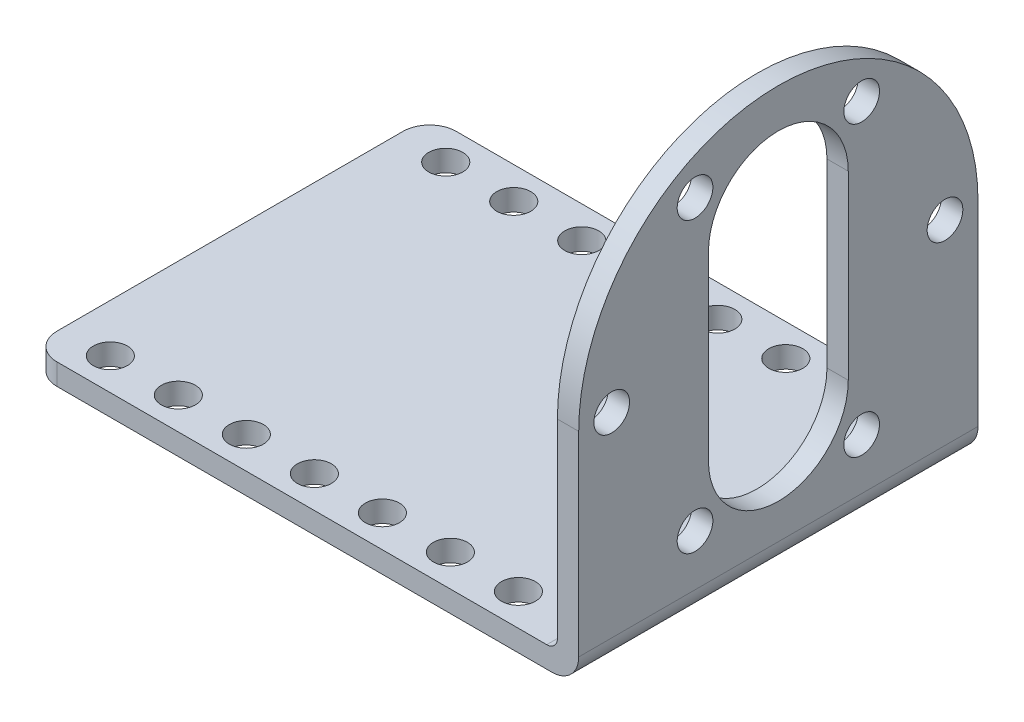
from build123d import *

# Parameters (mm, degrees)
SKETCH1_R           = 1.675
BOSS_EXTRUDE1_DEPTH = 2
SKETCH2_W           = 49.5
SKETCH2_H           = 37.5
SKETCH2_R           = 1.6
BOSS_EXTRUDE2_DEPTH = 2
FILLET1_R           = 2.5
FILLET2_R           = 1


with BuildPart() as part:
    # Sketch1 → Boss-Extrude1 (new body)
    with BuildSketch(Plane(origin=(0, 0, 0), x_dir=(0, 0, -1), z_dir=(1, 0, 0))):
        with BuildLine():
            Line((-18.75, 0), (18.75, 0))
            Line((18.75, 0), (18.75, 20.85))
            ThreePointArc((18.75, 20.85), (0, 39.6), (-18.75, 20.85))
            Line((-18.75, 20.85), (-18.75, 0))
        make_face()
        with Locations((-7.825, 7.296702431)):
            Circle(SKETCH1_R, mode=Mode.SUBTRACT)
        with Locations((7.825, 7.296702431)):
            Circle(SKETCH1_R, mode=Mode.SUBTRACT)
        with Locations((-15.65, 20.85)):
            Circle(SKETCH1_R, mode=Mode.SUBTRACT)
        with Locations((-7.825, 34.403297569)):
            Circle(SKETCH1_R, mode=Mode.SUBTRACT)
        with BuildLine():
            Line((-6.565, 12.35), (-6.565, 29.35))
            ThreePointArc((-6.565, 29.35), (0, 35.915), (6.565, 29.35))
            Line((6.565, 29.35), (6.565, 12.35))
            ThreePointArc((6.565, 12.35), (0, 5.785), (-6.565, 12.35))
        make_face(mode=Mode.SUBTRACT)
        with Locations((15.65, 20.85)):
            Circle(SKETCH1_R, mode=Mode.SUBTRACT)
        with Locations((7.825, 34.403297569)):
            Circle(SKETCH1_R, mode=Mode.SUBTRACT)
    extrude(amount=BOSS_EXTRUDE1_DEPTH)

    # Sketch2 → Boss-Extrude2 (add)
    with BuildSketch(Plane(origin=(0, 0, 0), x_dir=(1, 0, 0), z_dir=(0, 1, 0))):
        with Locations((-24.75, 0)):
            Rectangle(SKETCH2_W, SKETCH2_H)
        with Locations((-44.9875, 15.75)):
            Circle(SKETCH2_R, mode=Mode.SUBTRACT)
        with Locations((-38.6, 15.75)):
            Circle(SKETCH2_R, mode=Mode.SUBTRACT)
        with Locations((-32.2125, 15.75)):
            Circle(SKETCH2_R, mode=Mode.SUBTRACT)
        with Locations((-25.825, 15.75)):
            Circle(SKETCH2_R, mode=Mode.SUBTRACT)
        with Locations((-19.4375, 15.75)):
            Circle(SKETCH2_R, mode=Mode.SUBTRACT)
        with Locations((-13.05, 15.75)):
            Circle(SKETCH2_R, mode=Mode.SUBTRACT)
        with Locations((-6.6625, 15.75)):
            Circle(SKETCH2_R, mode=Mode.SUBTRACT)
        with Locations((-6.6625, -15.75)):
            Circle(SKETCH2_R, mode=Mode.SUBTRACT)
        with Locations((-13.05, -15.75)):
            Circle(SKETCH2_R, mode=Mode.SUBTRACT)
        with Locations((-19.4375, -15.75)):
            Circle(SKETCH2_R, mode=Mode.SUBTRACT)
        with Locations((-44.9875, -15.75)):
            Circle(SKETCH2_R, mode=Mode.SUBTRACT)
        with Locations((-38.6, -15.75)):
            Circle(SKETCH2_R, mode=Mode.SUBTRACT)
        with Locations((-32.2125, -15.75)):
            Circle(SKETCH2_R, mode=Mode.SUBTRACT)
        with Locations((-25.825, -15.75)):
            Circle(SKETCH2_R, mode=Mode.SUBTRACT)
    extrude(amount=BOSS_EXTRUDE2_DEPTH)

    # Fillet1
    fillet1_edges = [part.edges().sort_by_distance(p)[0] for p in [
        (2, 0, 0),
        (-49.5, 1, -18.75),
        (-49.5, 1, 18.75),
    ]]
    fillet(fillet1_edges, radius=FILLET1_R)

    # Fillet2
    fillet2_edges = [part.edges().sort_by_distance(p)[0] for p in [
        (0, 2, 0),
    ]]
    fillet(fillet2_edges, radius=FILLET2_R)


solid = part.part
